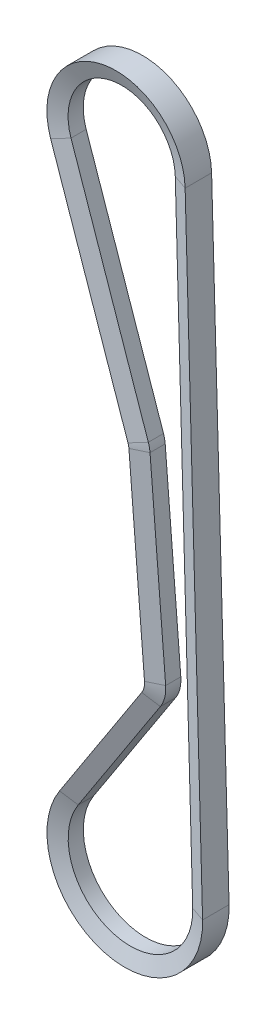
from build123d import *


with BuildPart() as part:
    # Sweep1: sweep along a path in Sketch2
    with BuildLine(Plane.XY) as sweep1_path:
        Line((24.865318756, 0.693937931), (31.141538819, -224.196798733))
        ThreePointArc((31.141538819, -224.196798733), (-4.434863045, -251.930333759), (-20.318842262, -209.710332114))
        Line((-20.318842262, -209.710332114), (9.242552171, -164.264779986))
        ThreePointArc((9.242552171, -164.264779986), (10.075044636, -162.362124324), (10.249113093, -160.292621378))
        Line((10.249113093, -160.292621378), (4.630494583, -90.5184777))
        ThreePointArc((4.630494583, -90.5184777), (4.516878734, -89.730037263), (4.305444614, -88.962025221))
        Line((4.305444614, -88.962025221), (-23.521414707, -8.093743068))
        ThreePointArc((-23.521414707, -8.093743068), (-4.444924505, 24.47464551), (24.865318756, 0.693937931))
    # Sketch3 → Sweep1 (sweep)
    with BuildSketch(Plane(origin=(-23.521414707, -8.093743068, 0), x_dir=(0.9455845095602013, 0.32537660530498147, 0), z_dir=(-0.32537660530498147, 0.9455845095602013, 0))):
        Polygon((0, -4.7625), (0, 4.7625), (5.588, 2.728634331), (5.588, -2.728634331), align=None)
    sweep(path=sweep1_path.line)


solid = part.part
